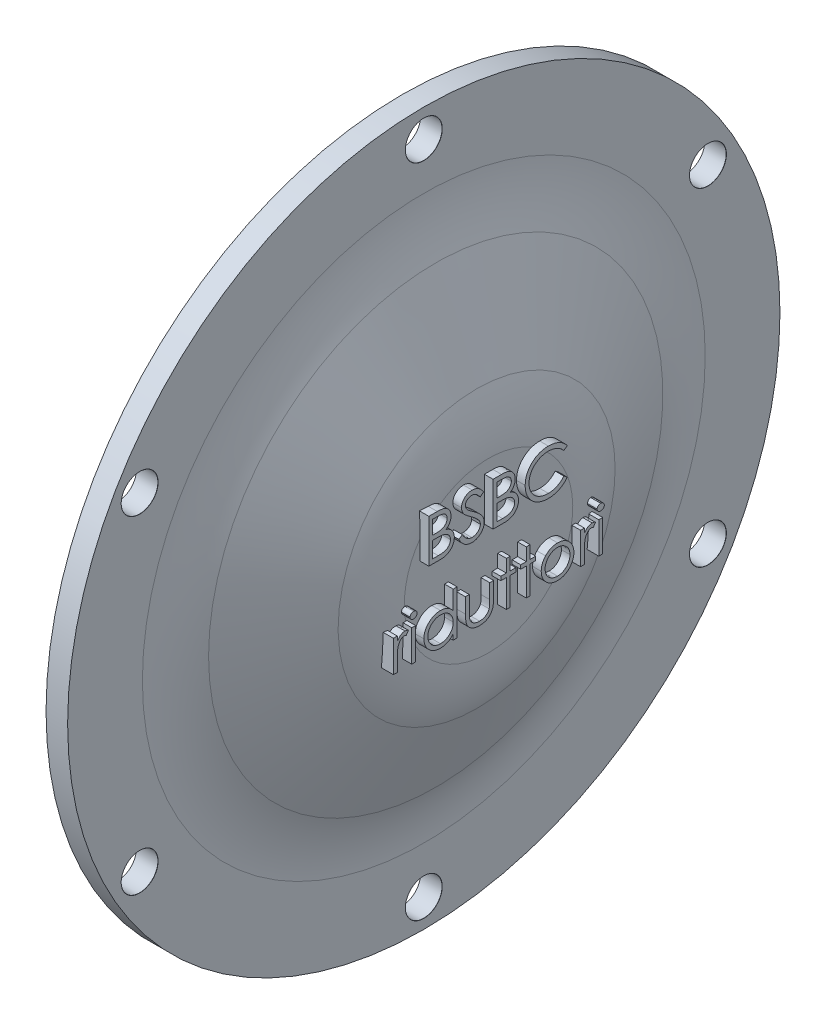
from build123d import *

# Parameters (mm, degrees)
RACCORDO4_R                             = 30
SCHIZZO5_R                              = 70
SCHIZZO5_R_2                            = 67
TAGLIO_ESTRUSIONE1_DEPTH                = 1.5
FORO_8_5_8_5_1_D                        = 8.5
FORO_8_5_8_5_1_CSINK_D                  = 8.55
FORO_8_5_8_5_1_CSINK_ANGLE              = 90
RIPETIZIONECIRCOLARE1_COUNT             = 6
ESTRUSIONE_ESTRUSIONE5_REACH            = 120.729
ESTRUSIONE_ESTRUSIONE5_END_MAJOR_RADIUS = 19.509078903
ESTRUSIONE_ESTRUSIONE5_END_MINOR_RADIUS = 30
SCHIZZO11_W                             = 0.897435897
SCHIZZO11_H                             = 7.307692307
SCHIZZO11_W_2                           = 0.897435898
SCHIZZO12_R                             = 62.5
SCHIZZO12_R_2                           = 57.5
ESTRUSIONE_ESTRUSIONE6_DEPTH            = 5
RACCORDO5_R                             = 30
SMUSSO1_SIZE                            = 1


with BuildPart() as part:
    # Schizzo4 → Rivoluzione2 (revolve)
    with BuildSketch(Plane.XY):
        Polygon((0, 0), (0, 25), (-15, 57.5), (-15, 82.5), (-10, 82.5), (-10, 58.598184219), (5, 26.098184219), (5, 0), align=None)
    revolve(axis=Axis((-10, 0, 0), (1, 0, 0)))

    # Raccordo4
    raccordo4_edges = [part.edges().sort_by_distance(p)[0] for p in [
        (5, -26.098184219, 0),
    ]]
    fillet(raccordo4_edges, radius=RACCORDO4_R)

    # Schizzo5 → Taglio-Estrusione1 (cut)
    with BuildSketch(Plane.ZY.offset(15)):
        Circle(SCHIZZO5_R)
        Circle(SCHIZZO5_R_2, mode=Mode.SUBTRACT)
    extrude(amount=-TAGLIO_ESTRUSIONE1_DEPTH, mode=Mode.SUBTRACT)

    # Foro Ø8.5 (8.5)-1 (through all)
    with Locations(Plane(origin=(-10, 0, 0), x_dir=(0, 0, -1), z_dir=(1, 0, 0))):
        with Locations((0, 76)):
            foro_8_5_8_5_1 = CounterSinkHole(FORO_8_5_8_5_1_D / 2, FORO_8_5_8_5_1_CSINK_D / 2, counter_sink_angle=FORO_8_5_8_5_1_CSINK_ANGLE)

    # RipetizioneCircolare1: Foro Ø8.5 (8.5)-1 ×6 about axis
    ripetizionecircolare1_axis = Axis((-10, 0, 0), (-1, 0, 0))
    for i in range(1, RIPETIZIONECIRCOLARE1_COUNT):
        add(foro_8_5_8_5_1.rotate(ripetizionecircolare1_axis, i * 360 / RIPETIZIONECIRCOLARE1_COUNT), mode=Mode.SUBTRACT)

    # Estrusione-Estrusione5: up to this torus (the profile starts outside it)
    estrusione_estrusione5_end = Plane(origin=(-25, 0, 0), z_dir=(-1, 0, 0)) * Torus(ESTRUSIONE_ESTRUSIONE5_END_MAJOR_RADIUS, ESTRUSIONE_ESTRUSIONE5_END_MINOR_RADIUS, mode=Mode.PRIVATE)
    # Schizzo11 → Estrusione-Estrusione5 (add, up to the surface)
    with BuildSketch(Plane(origin=(7, 0, 0), x_dir=(0, 0, -1), z_dir=(1, 0, 0)), mode=Mode.PRIVATE) as estrusione_estrusione5_sk1:
        with BuildLine():
            Line((-15.825314264, 16.793911957), (-13.874192469, 16.793911957))
            add(Edge.make_bspline(
                [(-13.874192469, 16.793911957), (-13.778682531, 16.793409813), (-13.593560502, 16.792436533), (-13.324362097, 16.777341873), (-13.072222638, 16.756759959), (-12.837069002, 16.724102551), (-12.619009853, 16.684697474), (-12.417388032, 16.636977999), (-12.232844683, 16.579759103), (-12.012522579, 16.488769728), (-11.76132069, 16.353560676), (-11.489325283, 16.153764775), (-11.256741742, 15.909386309), (-11.056209407, 15.633721579), (-10.896777636, 15.330476517), (-10.781436787, 15.006878835), (-10.708414286, 14.66710243), (-10.700904474, 14.433836207), (-10.697109136, 14.315947214)],
                knots=[0, 0, 0, 0, 1.001505555, 1.941167018, 2.826882275, 3.653841531, 4.429895133, 5.150066043, 5.825578002, 6.45369114, 7.647487171, 8.808567382, 9.977351308, 11.170798116, 12.373658725, 13.556498008, 14.765093433, 16, 16, 16, 16], degree=3))
            add(Edge.make_bspline(
                [(-10.697109136, 14.315947214), (-10.700232617, 14.20551134), (-10.706370552, 13.988494435), (-10.76506415, 13.671082694), (-10.856951774, 13.368936354), (-10.984681058, 13.08315811), (-11.150686761, 12.82020493), (-11.347424814, 12.577955598), (-11.584787107, 12.366666864), (-11.762624936, 12.248544285), (-11.852958495, 12.188543368)],
                knots=[0, 0, 0, 0, 1.044552857, 2.05264487, 3.044412934, 4.028983338, 5.005914585, 5.980388656, 6.974128949, 8, 8, 8, 8], degree=3))
            add(Edge.make_bspline(
                [(-11.852958495, 12.188543368), (-11.739357273, 12.144929085), (-11.522009995, 12.061484158), (-11.222907102, 11.913954261), (-10.965207545, 11.753491088), (-10.746929985, 11.578257231), (-10.560250971, 11.389374914), (-10.397242566, 11.184074588), (-10.258152926, 10.959678137), (-10.138973144, 10.718525179), (-10.045976699, 10.463078126), (-9.976331257, 10.195733052), (-9.93642426, 9.917448608), (-9.930745285, 9.72806181), (-9.927878366, 9.632453624)],
                knots=[0, 0, 0, 0, 1.27268992, 2.434971085, 3.483601985, 4.442670788, 5.356604649, 6.2567628, 7.179492994, 8.113709626, 9.066344395, 10.018646069, 10.999752585, 12, 12, 12, 12], degree=3))
            add(Edge.make_bspline(
                [(-9.927878366, 9.632453624), (-9.930669355, 9.534833989), (-9.936160703, 9.342764623), (-9.976674909, 9.060607096), (-10.045272357, 8.790964391), (-10.139761347, 8.532092441), (-10.263082246, 8.284492057), (-10.413162144, 8.047882731), (-10.592109468, 7.824641786), (-10.792289094, 7.612288577), (-11.018752367, 7.421352042), (-11.263083095, 7.251307166), (-11.528358295, 7.111461274), (-11.810221135, 6.993986927), (-12.111833466, 6.904252074), (-12.431840916, 6.841473292), (-12.769967493, 6.799173186), (-13.001995353, 6.795695458), (-13.120987341, 6.793911957)],
                knots=[0, 0, 0, 0, 0.978564426, 1.925352924, 2.850884081, 3.763762016, 4.682927383, 5.618979971, 6.567305752, 7.547517671, 8.540179244, 9.531824382, 10.526200242, 11.540722885, 12.589160233, 13.674978461, 14.80764778, 16, 16, 16, 16], degree=3))
            Line((-13.120987341, 6.793911957), (-15.825314264, 6.793911957))
            Line((-15.825314264, 6.793911957), (-15.825314264, 16.793911957))
        make_face()
        with BuildLine():
            Line((-14.927878366, 15.768270932), (-14.927878366, 12.563142727))
            Line((-14.927878366, 12.563142727), (-14.324913623, 12.563142727))
            add(Edge.make_bspline(
                [(-14.324913623, 12.563142727), (-14.236774207, 12.564285364), (-14.066470895, 12.566493172), (-13.819842619, 12.572817506), (-13.590913996, 12.590526201), (-13.380080187, 12.608229807), (-13.187673204, 12.637014344), (-13.014119314, 12.671277552), (-12.856694752, 12.707514424), (-12.675153193, 12.769141529), (-12.469230483, 12.860220601), (-12.249707329, 13.001568704), (-12.056180273, 13.169923999), (-11.892759736, 13.36418389), (-11.759012678, 13.578087278), (-11.666116349, 13.808221222), (-11.603124108, 14.048850171), (-11.597434018, 14.214045179), (-11.594545033, 14.297918368)],
                knots=[0, 0, 0, 0, 1.156816544, 2.235205308, 3.236616184, 4.169592532, 5.011045266, 5.787822928, 6.49130361, 7.128639758, 8.301311294, 9.436451833, 10.541879658, 11.654887649, 12.756523258, 13.837046038, 14.901820046, 16, 16, 16, 16], degree=3))
            add(Edge.make_bspline(
                [(-11.594545033, 14.297918368), (-11.596048405, 14.353420572), (-11.598997433, 14.462294206), (-11.623149726, 14.621006647), (-11.664199939, 14.770274511), (-11.716926491, 14.912143398), (-11.790608459, 15.042177256), (-11.877361211, 15.1648721), (-11.982177469, 15.276049582), (-12.101484077, 15.379962434), (-12.238651571, 15.472089657), (-12.393598119, 15.552777551), (-12.568420053, 15.617751199), (-12.760171067, 15.674654492), (-12.971802746, 15.714621045), (-13.200872899, 15.747916439), (-13.44925781, 15.76486713), (-13.62110096, 15.767111024), (-13.709929648, 15.768270932)],
                knots=[0, 0, 0, 0, 0.91205012, 1.789085906, 2.630437955, 3.453916878, 4.269457761, 5.079663411, 5.91843418, 6.774407191, 7.675494373, 8.627863946, 9.638891023, 10.736472738, 11.911756761, 13.175263542, 14.539845004, 16, 16, 16, 16], degree=3))
            Line((-13.709929648, 15.768270932), (-14.927878366, 15.768270932))
        make_face(mode=Mode.SUBTRACT)
        with BuildLine():
            Line((-14.927878366, 11.537501701), (-14.927878366, 7.819552983))
            Line((-14.927878366, 7.819552983), (-13.649833495, 7.819552983))
            add(Edge.make_bspline(
                [(-13.649833495, 7.819552983), (-13.558350849, 7.820649404), (-13.38203011, 7.822762611), (-13.127455167, 7.829661339), (-12.891503442, 7.845353555), (-12.675251626, 7.870055982), (-12.476364618, 7.896851552), (-12.297228324, 7.932883783), (-12.136390628, 7.974166527), (-11.949892606, 8.037978448), (-11.739882582, 8.137111222), (-11.51356585, 8.28658044), (-11.312348084, 8.464647034), (-11.141475915, 8.67073536), (-11.001438804, 8.894824866), (-10.899566076, 9.132383008), (-10.836735056, 9.379484515), (-10.829128858, 9.547960837), (-10.825314264, 9.632453624)],
                knots=[0, 0, 0, 0, 1.160039823, 2.235823828, 3.228722157, 4.157150951, 4.99529583, 5.772374946, 6.472645482, 7.099169577, 8.269452708, 9.405989375, 10.527446681, 11.663510218, 12.788923519, 13.866172445, 14.929861265, 16, 16, 16, 16], degree=3))
            add(Edge.make_bspline(
                [(-10.825314264, 9.632453624), (-10.826103133, 9.68529174), (-10.827668148, 9.790115688), (-10.851269905, 9.944160885), (-10.885595247, 10.093377666), (-10.929970772, 10.23817121), (-10.994597821, 10.375923714), (-11.070045093, 10.509359599), (-11.15850624, 10.638655254), (-11.296346714, 10.802118835), (-11.496838099, 10.990453158), (-11.7817146, 11.174846022), (-12.105635451, 11.323554042), (-12.340571145, 11.386695403), (-12.461932854, 11.419312598)],
                knots=[0, 0, 0, 0, 0.723448775, 1.435228256, 2.130040452, 2.821711965, 3.505591119, 4.210454504, 4.921174351, 5.648778258, 7.137944449, 8.670945889, 10.280296675, 12, 12, 12, 12], degree=3))
            add(Edge.make_bspline(
                [(-12.461932854, 11.419312598), (-12.510587413, 11.429184267), (-12.616080534, 11.45058808), (-12.788102193, 11.473181518), (-12.984490389, 11.493310261), (-13.20569861, 11.508199283), (-13.452006727, 11.523589407), (-13.723940781, 11.52957461), (-14.020390251, 11.536715354), (-14.226082744, 11.53723288), (-14.332926443, 11.537501701)],
                knots=[0, 0, 0, 0, 0.634451884, 1.375622551, 2.216452059, 3.157844607, 4.20941857, 5.370758133, 6.634282058, 8, 8, 8, 8], degree=3))
            Line((-14.332926443, 11.537501701), (-14.927878366, 11.537501701))
        make_face(mode=Mode.SUBTRACT)
    estrusione_estrusione5_tool1 = extrude(estrusione_estrusione5_sk1.sketch, amount=-ESTRUSIONE_ESTRUSIONE5_REACH, mode=Mode.PRIVATE) - estrusione_estrusione5_end
    add(estrusione_estrusione5_tool1.solids().sort_by_distance((7, 11.716905, 13.304487))[0])
    # Schizzo11 → Estrusione-Estrusione5 (add, up to the surface)
    with BuildSketch(Plane(origin=(7, 0, 0), x_dir=(0, 0, -1), z_dir=(1, 0, 0)), mode=Mode.PRIVATE) as estrusione_estrusione5_sk2:
        with BuildLine():
            Line((-8.902237341, 8.722998496), (-8.056884777, 9.229809393))
            add(Edge.make_bspline(
                [(-8.056884777, 9.229809393), (-7.978261242, 9.098196865), (-7.827621583, 8.846032339), (-7.576331985, 8.505295081), (-7.315952239, 8.215688919), (-7.044554143, 7.978898612), (-6.763794291, 7.792473221), (-6.471839852, 7.660466844), (-6.169674679, 7.578135486), (-5.964035189, 7.568135239), (-5.861371956, 7.563142727)],
                knots=[0, 0, 0, 0, 1.272034388, 2.437168799, 3.508375237, 4.49857839, 5.41946034, 6.295179144, 7.148887113, 8, 8, 8, 8], degree=3))
            add(Edge.make_bspline(
                [(-5.861371956, 7.563142727), (-5.773695212, 7.565584648), (-5.59987586, 7.570425763), (-5.343983738, 7.61694234), (-5.095464302, 7.688405566), (-4.859439623, 7.790751084), (-4.639166439, 7.914575329), (-4.446004452, 8.064135836), (-4.279015557, 8.231582138), (-4.142418087, 8.418389723), (-4.037617986, 8.619295862), (-3.957069219, 8.825512866), (-3.912369009, 9.040280204), (-3.905635428, 9.184881526), (-3.902237341, 9.257854265)],
                knots=[0, 0, 0, 0, 1.095163259, 2.171163733, 3.241058638, 4.321873601, 5.38011039, 6.391990106, 7.366004449, 8.327778327, 9.272591725, 10.192022065, 11.087607919, 12, 12, 12, 12], degree=3))
            add(Edge.make_bspline(
                [(-3.902237341, 9.257854265), (-3.906449657, 9.341113836), (-3.915012681, 9.510368376), (-3.987388338, 9.76008167), (-4.101243329, 10.007203299), (-4.206279454, 10.160064058), (-4.260811059, 10.239424778)],
                knots=[0, 0, 0, 0, 0.938893495, 1.908633276, 2.914225137, 4, 4, 4, 4], degree=3))
            add(Edge.make_bspline(
                [(-4.260811059, 10.239424778), (-4.305584242, 10.296701417), (-4.39957994, 10.416946555), (-4.561172833, 10.595932943), (-4.750790303, 10.780556997), (-4.961943317, 10.977868588), (-5.20232357, 11.178690864), (-5.464402183, 11.39260023), (-5.754870352, 11.611461878), (-5.958583199, 11.758240637), (-6.063695674, 11.83397606)],
                knots=[0, 0, 0, 0, 0.722233717, 1.516239348, 2.393582979, 3.351407094, 4.387010283, 5.505090956, 6.712668013, 8, 8, 8, 8], degree=3))
            add(Edge.make_bspline(
                [(-6.063695674, 11.83397606), (-6.168907092, 11.908914882), (-6.370063311, 12.052192202), (-6.651373546, 12.264833014), (-6.902929154, 12.45924407), (-7.123612059, 12.637255533), (-7.313325193, 12.798891546), (-7.47356351, 12.942599944), (-7.600245102, 13.072267261), (-7.670689618, 13.15638538), (-7.702317469, 13.194152342)],
                knots=[0, 0, 0, 0, 1.452282411, 2.77665338, 3.964542531, 5.026858415, 5.96415736, 6.766646006, 7.446254459, 8, 8, 8, 8], degree=3))
            add(Edge.make_bspline(
                [(-7.702317469, 13.194152342), (-7.746524741, 13.253012447), (-7.833464275, 13.368768744), (-7.94822429, 13.549696909), (-8.045764755, 13.734906238), (-8.122228561, 13.924894423), (-8.186617758, 14.11699422), (-8.229926132, 14.313712065), (-8.257044408, 14.51416526), (-8.259821513, 14.649060976), (-8.2612117, 14.716588239)],
                knots=[0, 0, 0, 0, 1.068054152, 2.10047183, 3.106115577, 4.101338837, 5.06977816, 6.043150881, 7.020423561, 8, 8, 8, 8], degree=3))
            add(Edge.make_bspline(
                [(-8.2612117, 14.716588239), (-8.257482531, 14.822387595), (-8.250103902, 15.03172492), (-8.187702425, 15.337527293), (-8.089208443, 15.629488485), (-7.951223049, 15.90471801), (-7.773344898, 16.156049384), (-7.567499257, 16.386373632), (-7.322323582, 16.579998153), (-7.053316087, 16.749175463), (-6.758869309, 16.881592392), (-6.450323871, 16.981480907), (-6.127189379, 17.038078786), (-5.90832328, 17.046200971), (-5.797269392, 17.050322214)],
                knots=[0, 0, 0, 0, 1.005424448, 1.989358655, 2.955360095, 3.929531133, 4.905563448, 5.876582895, 6.856512386, 7.866279853, 8.892233794, 9.918561126, 10.94386622, 12, 12, 12, 12], degree=3))
            add(Edge.make_bspline(
                [(-5.797269392, 17.050322214), (-5.679429105, 17.046257781), (-5.445082386, 17.03817492), (-5.100370342, 16.967896259), (-4.768482581, 16.851608626), (-4.501501824, 16.719641031), (-4.292551077, 16.587836987), (-4.133200412, 16.467780346), (-3.971721981, 16.32956575), (-3.806813253, 16.172825047), (-3.641268512, 15.996120044), (-3.472630077, 15.800660932), (-3.300503595, 15.587642201), (-3.189772566, 15.435572199), (-3.133006572, 15.35761388)],
                knots=[0, 0, 0, 0, 1.286793592, 2.559021753, 3.825965368, 5.121522368, 5.803751409, 6.523245864, 7.299691795, 8.125521123, 9.008227632, 9.944561021, 10.946284179, 12, 12, 12, 12], degree=3))
            Line((-3.133006572, 15.35761388), (-3.944304648, 14.742629906))
            add(Edge.make_bspline(
                [(-3.944304648, 14.742629906), (-3.993293027, 14.80574045), (-4.08763319, 14.927276602), (-4.230860295, 15.097480361), (-4.365856432, 15.252956017), (-4.498857574, 15.38799924), (-4.622839379, 15.510005335), (-4.743173785, 15.614461783), (-4.858129074, 15.702392056), (-5.003034533, 15.796230798), (-5.185085157, 15.88924938), (-5.413612404, 15.967961032), (-5.652430332, 16.015261209), (-5.815086422, 16.021515173), (-5.897429648, 16.024681188)],
                knots=[0, 0, 0, 0, 1.181633172, 2.275549214, 3.290209073, 4.226197932, 5.078386478, 5.862611352, 6.581680152, 7.217281963, 8.414376989, 9.595101626, 10.782541182, 12, 12, 12, 12], degree=3))
            add(Edge.make_bspline(
                [(-5.897429648, 16.024681188), (-6.000733998, 16.021219188), (-6.199946705, 16.014543048), (-6.482775951, 15.941628804), (-6.737330023, 15.826823489), (-6.956051637, 15.665923551), (-7.138157286, 15.475292144), (-7.269887168, 15.255923986), (-7.349173352, 15.01368855), (-7.358848437, 14.844712389), (-7.363775802, 14.758655547)],
                knots=[0, 0, 0, 0, 1.14458467, 2.207223713, 3.21896685, 4.227309161, 5.202851033, 6.127160689, 7.046193047, 8, 8, 8, 8], degree=3))
            add(Edge.make_bspline(
                [(-7.363775802, 14.758655547), (-7.362652583, 14.705079894), (-7.360404309, 14.597840981), (-7.329047744, 14.439408347), (-7.288763947, 14.281375949), (-7.224927856, 14.124454284), (-7.136798417, 13.965898972), (-7.021069343, 13.802979722), (-6.875317023, 13.634260554), (-6.763668416, 13.524525201), (-6.704721315, 13.466588239)],
                knots=[0, 0, 0, 0, 0.858281714, 1.717966888, 2.583508476, 3.4729293, 4.427298488, 5.488583878, 6.674047936, 8, 8, 8, 8], degree=3))
            add(Edge.make_bspline(
                [(-6.704721315, 13.466588239), (-6.68283168, 13.44705388), (-6.630826916, 13.400644713), (-6.535752843, 13.324666769), (-6.410201991, 13.230944562), (-6.257452845, 13.114980801), (-6.074688954, 12.980462337), (-5.861890222, 12.82910916), (-5.6214287, 12.656007848), (-5.450794654, 12.534986304), (-5.360570674, 12.470995291)],
                knots=[0, 0, 0, 0, 0.420754252, 0.999615792, 1.744751191, 2.668019286, 3.750313428, 4.999500688, 6.413464383, 8, 8, 8, 8], degree=3))
            add(Edge.make_bspline(
                [(-5.360570674, 12.470995291), (-5.252039493, 12.392019978), (-5.041883904, 12.23909523), (-4.742862247, 12.009336144), (-4.471737081, 11.784628234), (-4.227556499, 11.566406499), (-4.007908189, 11.356326233), (-3.815228987, 11.151860004), (-3.647555615, 10.954472653), (-3.467043562, 10.701408151), (-3.282592649, 10.390605054), (-3.124188342, 10.009810086), (-3.02430735, 9.627534885), (-3.011245877, 9.370601066), (-3.004801443, 9.243831829)],
                knots=[0, 0, 0, 0, 1.163667725, 2.253281268, 3.268753668, 4.215851969, 5.092017293, 5.902905408, 6.650798638, 7.335211899, 8.59617414, 9.77448103, 10.901945474, 12, 12, 12, 12], degree=3))
            add(Edge.make_bspline(
                [(-3.004801443, 9.243831829), (-3.006678981, 9.154179357), (-3.010397595, 8.976615404), (-3.053143063, 8.715886613), (-3.115770678, 8.462655557), (-3.210162775, 8.220052379), (-3.325371799, 7.983638771), (-3.471561078, 7.759616198), (-3.641011606, 7.543026488), (-3.835393791, 7.339645084), (-4.04809637, 7.152941667), (-4.272906926, 6.986858634), (-4.51019342, 6.84837771), (-4.75866861, 6.735375305), (-5.018389572, 6.646993826), (-5.289268955, 6.582957057), (-5.571753272, 6.543655026), (-5.763754648, 6.539575707), (-5.861371956, 6.537501701)],
                knots=[0, 0, 0, 0, 0.983748083, 1.948392443, 2.894712957, 3.844097841, 4.80183111, 5.778335162, 6.776009319, 7.81870978, 8.863265674, 9.881300176, 10.883814829, 11.87499822, 12.874611388, 13.892143829, 14.928324115, 16, 16, 16, 16], degree=3))
            add(Edge.make_bspline(
                [(-5.861371956, 6.537501701), (-5.936901508, 6.53896222), (-6.087009393, 6.541864864), (-6.309036484, 6.567525665), (-6.526578168, 6.603831675), (-6.736904688, 6.661471875), (-6.942725864, 6.731406095), (-7.143146534, 6.817515617), (-7.338263831, 6.920707621), (-7.529171211, 7.038693406), (-7.715383138, 7.176001247), (-7.895153046, 7.335925523), (-8.074379291, 7.514055537), (-8.247771852, 7.715228575), (-8.418837978, 7.936194526), (-8.584204862, 8.179020765), (-8.747295484, 8.442384632), (-8.849625393, 8.627713449), (-8.902237341, 8.722998496)],
                knots=[0, 0, 0, 0, 0.915332311, 1.819136955, 2.706846663, 3.586547465, 4.459518054, 5.340707479, 6.227863349, 7.133153174, 8.059268498, 9.028702269, 10.047606654, 11.120612155, 12.245963614, 13.433783089, 14.680604001, 16, 16, 16, 16], degree=3))
        make_face()
    estrusione_estrusione5_tool2 = extrude(estrusione_estrusione5_sk2.sketch, amount=-ESTRUSIONE_ESTRUSIONE5_REACH, mode=Mode.PRIVATE) - estrusione_estrusione5_end
    add(estrusione_estrusione5_tool2.solids().sort_by_distance((7, 11.663702, 5.753573))[0])
    # Schizzo11 → Estrusione-Estrusione5 (add, up to the surface)
    with BuildSketch(Plane(origin=(7, 0, 0), x_dir=(0, 0, -1), z_dir=(1, 0, 0)), mode=Mode.PRIVATE) as estrusione_estrusione5_sk3:
        with BuildLine():
            Line((-0.953519392, 16.793911957), (0.997602403, 16.793911957))
            add(Edge.make_bspline(
                [(0.997602403, 16.793911957), (1.093112341, 16.793409813), (1.27823437, 16.792436533), (1.547432775, 16.777341873), (1.799572234, 16.756759959), (2.03472587, 16.724102551), (2.252785019, 16.684697474), (2.45440684, 16.636977999), (2.638950189, 16.579759103), (2.859272293, 16.488769728), (3.110474181, 16.353560676), (3.382469589, 16.153764775), (3.61505313, 15.909386309), (3.815585465, 15.633721579), (3.975017236, 15.330476517), (4.090358085, 15.006878835), (4.163380586, 14.66710243), (4.170890398, 14.433836207), (4.174685736, 14.315947214)],
                knots=[0, 0, 0, 0, 1.001505555, 1.941167018, 2.826882275, 3.653841531, 4.429895133, 5.150066043, 5.825578002, 6.45369114, 7.647487171, 8.808567382, 9.977351308, 11.170798116, 12.373658725, 13.556498008, 14.765093433, 16, 16, 16, 16], degree=3))
            add(Edge.make_bspline(
                [(4.174685736, 14.315947214), (4.171562255, 14.20551134), (4.16542432, 13.988494435), (4.106730722, 13.671082694), (4.014843097, 13.368936354), (3.887113814, 13.08315811), (3.721108111, 12.82020493), (3.524370057, 12.577955598), (3.287007765, 12.366666864), (3.109169936, 12.248544285), (3.018836377, 12.188543368)],
                knots=[0, 0, 0, 0, 1.044552857, 2.05264487, 3.044412934, 4.028983338, 5.005914585, 5.980388656, 6.974128949, 8, 8, 8, 8], degree=3))
            add(Edge.make_bspline(
                [(3.018836377, 12.188543368), (3.132437599, 12.144929085), (3.349784877, 12.061484158), (3.64888777, 11.913954261), (3.906587327, 11.753491088), (4.124864887, 11.578257231), (4.311543901, 11.389374914), (4.474552305, 11.184074588), (4.613641946, 10.959678137), (4.732821727, 10.718525179), (4.825818173, 10.463078126), (4.895463614, 10.195733052), (4.935370612, 9.917448608), (4.941049587, 9.72806181), (4.943916505, 9.632453624)],
                knots=[0, 0, 0, 0, 1.27268992, 2.434971085, 3.483601985, 4.442670788, 5.356604649, 6.2567628, 7.179492994, 8.113709626, 9.066344395, 10.018646069, 10.999752585, 12, 12, 12, 12], degree=3))
            add(Edge.make_bspline(
                [(4.943916505, 9.632453624), (4.941125517, 9.534833989), (4.935634168, 9.342764623), (4.895119963, 9.060607096), (4.826522515, 8.790964391), (4.732033525, 8.532092441), (4.608712626, 8.284492057), (4.458632728, 8.047882731), (4.279685404, 7.824641786), (4.079505778, 7.612288577), (3.853042505, 7.421352042), (3.608711777, 7.251307166), (3.343436577, 7.111461274), (3.061573737, 6.993986927), (2.759961405, 6.904252074), (2.439953956, 6.841473292), (2.101827379, 6.799173186), (1.869799519, 6.795695458), (1.750807531, 6.793911957)],
                knots=[0, 0, 0, 0, 0.978564426, 1.925352924, 2.850884081, 3.763762016, 4.682927383, 5.618979971, 6.567305752, 7.547517671, 8.540179244, 9.531824382, 10.526200242, 11.540722885, 12.589160233, 13.674978461, 14.80764778, 16, 16, 16, 16], degree=3))
            Line((1.750807531, 6.793911957), (-0.953519392, 6.793911957))
            Line((-0.953519392, 6.793911957), (-0.953519392, 16.793911957))
        make_face()
        with BuildLine():
            Line((-0.056083495, 15.768270932), (-0.056083495, 12.563142727))
            Line((-0.056083495, 12.563142727), (0.546881249, 12.563142727))
            add(Edge.make_bspline(
                [(0.546881249, 12.563142727), (0.635020664, 12.564285364), (0.805323976, 12.566493172), (1.051952252, 12.572817506), (1.280880876, 12.590526201), (1.491714685, 12.608229807), (1.684121667, 12.637014344), (1.857675557, 12.671277552), (2.01510012, 12.707514424), (2.196641679, 12.769141529), (2.402564389, 12.860220601), (2.622087543, 13.001568704), (2.815614599, 13.169923999), (2.979035136, 13.36418389), (3.112782194, 13.578087278), (3.205678523, 13.808221222), (3.268670764, 14.048850171), (3.274360853, 14.214045179), (3.277249839, 14.297918368)],
                knots=[0, 0, 0, 0, 1.156816544, 2.235205308, 3.236616184, 4.169592532, 5.011045266, 5.787822928, 6.49130361, 7.128639758, 8.301311294, 9.436451833, 10.541879658, 11.654887649, 12.756523258, 13.837046038, 14.901820046, 16, 16, 16, 16], degree=3))
            add(Edge.make_bspline(
                [(3.277249839, 14.297918368), (3.275746467, 14.353420572), (3.272797439, 14.462294206), (3.248645145, 14.621006647), (3.207594933, 14.770274511), (3.154868381, 14.912143398), (3.081186413, 15.042177256), (2.994433661, 15.1648721), (2.889617403, 15.276049582), (2.770310795, 15.379962434), (2.633143301, 15.472089657), (2.478196753, 15.552777551), (2.303374819, 15.617751199), (2.111623804, 15.674654492), (1.899992126, 15.714621045), (1.670921973, 15.747916439), (1.422537062, 15.76486713), (1.250693912, 15.767111024), (1.161865223, 15.768270932)],
                knots=[0, 0, 0, 0, 0.91205012, 1.789085906, 2.630437955, 3.453916878, 4.269457761, 5.079663411, 5.91843418, 6.774407191, 7.675494373, 8.627863946, 9.638891023, 10.736472738, 11.911756761, 13.175263542, 14.539845004, 16, 16, 16, 16], degree=3))
            Line((1.161865223, 15.768270932), (-0.056083495, 15.768270932))
        make_face(mode=Mode.SUBTRACT)
        with BuildLine():
            Line((-0.056083495, 11.537501701), (-0.056083495, 7.819552983))
            Line((-0.056083495, 7.819552983), (1.221961377, 7.819552983))
            add(Edge.make_bspline(
                [(1.221961377, 7.819552983), (1.313444023, 7.820649404), (1.489764761, 7.822762611), (1.744339705, 7.829661339), (1.98029143, 7.845353555), (2.196543246, 7.870055982), (2.395430254, 7.896851552), (2.574566548, 7.932883783), (2.735404244, 7.974166527), (2.921902266, 8.037978448), (3.131912289, 8.137111222), (3.358229022, 8.28658044), (3.559446788, 8.464647034), (3.730318957, 8.67073536), (3.870356067, 8.894824866), (3.972228796, 9.132383008), (4.035059815, 9.379484515), (4.042666013, 9.547960837), (4.046480608, 9.632453624)],
                knots=[0, 0, 0, 0, 1.160039823, 2.235823828, 3.228722157, 4.157150951, 4.99529583, 5.772374946, 6.472645482, 7.099169577, 8.269452708, 9.405989375, 10.527446681, 11.663510218, 12.788923519, 13.866172445, 14.929861265, 16, 16, 16, 16], degree=3))
            add(Edge.make_bspline(
                [(4.046480608, 9.632453624), (4.045691738, 9.68529174), (4.044126724, 9.790115688), (4.020524967, 9.944160885), (3.986199625, 10.093377666), (3.941824099, 10.23817121), (3.87719705, 10.375923714), (3.801749779, 10.509359599), (3.713288631, 10.638655254), (3.575448158, 10.802118835), (3.374956773, 10.990453158), (3.090080272, 11.174846022), (2.766159421, 11.323554042), (2.531223727, 11.386695403), (2.409862018, 11.419312598)],
                knots=[0, 0, 0, 0, 0.723448775, 1.435228256, 2.130040452, 2.821711965, 3.505591119, 4.210454504, 4.921174351, 5.648778258, 7.137944449, 8.670945889, 10.280296675, 12, 12, 12, 12], degree=3))
            add(Edge.make_bspline(
                [(2.409862018, 11.419312598), (2.361207459, 11.429184267), (2.255714338, 11.45058808), (2.083692679, 11.473181518), (1.887304482, 11.493310261), (1.666096262, 11.508199283), (1.419788144, 11.523589407), (1.147854091, 11.52957461), (0.85140462, 11.536715354), (0.645712128, 11.53723288), (0.538868428, 11.537501701)],
                knots=[0, 0, 0, 0, 0.634451884, 1.375622551, 2.216452059, 3.157844607, 4.20941857, 5.370758133, 6.634282058, 8, 8, 8, 8], degree=3))
            Line((0.538868428, 11.537501701), (-0.056083495, 11.537501701))
        make_face(mode=Mode.SUBTRACT)
    estrusione_estrusione5_tool3 = extrude(estrusione_estrusione5_sk3.sketch, amount=-ESTRUSIONE_ESTRUSIONE5_REACH, mode=Mode.PRIVATE) - estrusione_estrusione5_end
    add(estrusione_estrusione5_tool3.solids().sort_by_distance((7, 11.716905, -1.567308))[0])
    # Schizzo11 → Estrusione-Estrusione5 (add, up to the surface)
    with BuildSketch(Plane(origin=(7, 0, 0), x_dir=(0, 0, -1), z_dir=(1, 0, 0)), mode=Mode.PRIVATE) as estrusione_estrusione5_sk4:
        with BuildLine():
            Line((16.225967787, 14.95897606), (15.440711377, 14.358014521))
            add(Edge.make_bspline(
                [(15.440711377, 14.358014521), (15.384694553, 14.424774435), (15.273416134, 14.557394194), (15.094389841, 14.743621464), (14.907813718, 14.91809364), (14.713759086, 15.081641867), (14.508733031, 15.228546912), (14.297702177, 15.366464349), (14.077136334, 15.490086458), (13.772131378, 15.639980704), (13.373137525, 15.796398289), (12.870866557, 15.927550379), (12.346549132, 16.011039452), (11.988841705, 16.020081856), (11.806897275, 16.024681188)],
                knots=[0, 0, 0, 0, 0.757959112, 1.505699292, 2.245454638, 2.979532153, 3.711538275, 4.438200793, 5.171680507, 5.909471876, 7.393775596, 8.890124382, 10.418191784, 12, 12, 12, 12], degree=3))
            add(Edge.make_bspline(
                [(11.806897275, 16.024681188), (11.706659277, 16.023527009), (11.507113583, 16.021229364), (11.210975088, 15.990917578), (10.92036637, 15.948314121), (10.635476467, 15.885098911), (10.356668014, 15.805177143), (10.082118294, 15.70967596), (9.815802294, 15.591519275), (9.554035899, 15.460924246), (9.303238154, 15.313417261), (9.065938017, 15.15252197), (8.843000966, 14.980038837), (8.634250645, 14.795321391), (8.43947365, 14.599201504), (8.260081334, 14.389589099), (8.096694447, 14.167154318), (7.946074376, 13.934830296), (7.811180852, 13.693293748), (7.698238339, 13.44165069), (7.598223704, 13.184210396), (7.519083011, 12.918064222), (7.456441534, 12.645084891), (7.413219639, 12.364539782), (7.383252579, 12.077014984), (7.380966359, 11.882131233), (7.379813941, 11.783895932)],
                knots=[0, 0, 0, 0, 1.054917814, 2.100044995, 3.131103042, 4.146048494, 5.169673617, 6.183595914, 7.203665975, 8.234915748, 9.262203917, 10.264457458, 11.251630812, 12.227803204, 13.197192746, 14.159520551, 15.12972552, 16.100847026, 17.073214652, 18.039054194, 19.002613845, 19.979014051, 20.95965708, 21.949030935, 22.966165397, 24, 24, 24, 24], degree=3))
            add(Edge.make_bspline(
                [(7.379813941, 11.783895932), (7.383419139, 11.63609216), (7.390497465, 11.345899061), (7.453492705, 10.920840174), (7.549221538, 10.513638249), (7.692694614, 10.126838699), (7.869606187, 9.755671962), (8.093150792, 9.406418095), (8.352055184, 9.073799339), (8.649982097, 8.765676631), (8.976855857, 8.484208845), (9.327564176, 8.23635004), (9.701233569, 8.02973609), (10.093738227, 7.857804815), (10.508098553, 7.725642736), (10.943569417, 7.632602383), (11.399203689, 7.571910438), (11.710544831, 7.566099901), (11.868996634, 7.563142727)],
                knots=[0, 0, 0, 0, 1.029171465, 2.020641659, 2.987623507, 3.938342917, 4.889210282, 5.84687017, 6.821220943, 7.821438502, 8.827599549, 9.822697543, 10.807740252, 11.797342354, 12.80366471, 13.83203677, 14.896651826, 16, 16, 16, 16], degree=3))
            add(Edge.make_bspline(
                [(11.868996634, 7.563142727), (12.043575745, 7.567967812), (12.387189199, 7.577464733), (12.891097846, 7.657919731), (13.373485748, 7.788370924), (13.834378852, 7.970936417), (14.272477841, 8.208265811), (14.688468299, 8.495974032), (15.082701358, 8.83679784), (15.319762164, 9.097035349), (15.440711377, 9.229809393)],
                knots=[0, 0, 0, 0, 1.028121516, 2.023589091, 2.998037872, 3.967518031, 4.937445131, 5.927275754, 6.942489185, 8, 8, 8, 8], degree=3))
            Line((15.440711377, 9.229809393), (16.225967787, 8.63485747))
            add(Edge.make_bspline(
                [(16.225967787, 8.63485747), (16.162773188, 8.553319036), (16.036686687, 8.390632732), (15.832520924, 8.16128499), (15.617442932, 7.945559175), (15.389855189, 7.745194543), (15.152375784, 7.556181784), (14.900740606, 7.383890837), (14.638257656, 7.225916882), (14.365816288, 7.081268526), (14.083705966, 6.952933535), (13.792264723, 6.843065627), (13.492748793, 6.748423085), (13.185144483, 6.670560409), (12.868813749, 6.609785884), (12.544898109, 6.569158241), (12.212698466, 6.5413242), (11.988580119, 6.538787298), (11.875006249, 6.537501701)],
                knots=[0, 0, 0, 0, 0.986787822, 1.968848986, 2.935600012, 3.899624008, 4.868462664, 5.837806735, 6.815139263, 7.798259679, 8.787526145, 9.778297419, 10.776456485, 11.791383307, 12.812564526, 13.85620153, 14.913611965, 16, 16, 16, 16], degree=3))
            add(Edge.make_bspline(
                [(11.875006249, 6.537501701), (11.767452915, 6.538250251), (11.554779514, 6.539730416), (11.240783081, 6.563708037), (10.935098565, 6.596421571), (10.638599633, 6.645679089), (10.349668276, 6.703805775), (10.070923749, 6.781723651), (9.799623148, 6.869006984), (9.53685646, 6.97159266), (9.282400175, 7.087353182), (9.037075, 7.218186207), (8.800993764, 7.362991535), (8.571835419, 7.518577279), (8.35298518, 7.689940999), (8.142546536, 7.874702811), (7.939339461, 8.072239985), (7.813617504, 8.214682423), (7.75040689, 8.286299778)],
                knots=[0, 0, 0, 0, 1.114604814, 2.203992996, 3.262667896, 4.300477797, 5.318619304, 6.316056647, 7.298880507, 8.271930387, 9.238335007, 10.195173496, 11.151986948, 12.108099108, 13.064862484, 14.031167946, 15.010108607, 16, 16, 16, 16], degree=3))
            add(Edge.make_bspline(
                [(7.75040689, 8.286299778), (7.649162194, 8.410703175), (7.447895118, 8.658008062), (7.190393165, 9.058825151), (6.969971578, 9.477305748), (6.791754662, 9.915648401), (6.652432567, 10.372869508), (6.555914867, 10.849199549), (6.493195997, 11.344193669), (6.486023743, 11.680870209), (6.482378044, 11.852004906)],
                knots=[0, 0, 0, 0, 0.994628077, 1.977248131, 2.950237994, 3.925870899, 4.908910175, 5.911660606, 6.938484602, 8, 8, 8, 8], degree=3))
            add(Edge.make_bspline(
                [(6.482378044, 11.852004906), (6.486821454, 12.03187763), (6.495563586, 12.385765986), (6.569837287, 12.905120139), (6.689319562, 13.402695564), (6.859024958, 13.877563406), (7.074183105, 14.332221349), (7.33997343, 14.76319622), (7.653308122, 15.173244219), (8.011729744, 15.556143508), (8.404779274, 15.906255945), (8.82569017, 16.21427367), (9.27363859, 16.47060943), (9.743689595, 16.684884179), (10.239362971, 16.849582645), (10.759601169, 16.964877465), (11.303426639, 17.036640654), (11.674462141, 17.045712677), (11.862987018, 17.050322214)],
                knots=[0, 0, 0, 0, 1.032925535, 2.032216505, 3.007276963, 3.968222605, 4.92396291, 5.891752235, 6.871517503, 7.883894988, 8.900124299, 9.891468569, 10.874487609, 11.85992873, 12.854644235, 13.869047385, 14.917252991, 16, 16, 16, 16], degree=3))
            add(Edge.make_bspline(
                [(11.862987018, 17.050322214), (11.977885509, 17.048944676), (12.205315502, 17.046217979), (12.541751652, 17.019629001), (12.869301157, 16.975304412), (13.188189677, 16.914972784), (13.499968581, 16.840094723), (13.802254983, 16.742551013), (14.09682266, 16.631018067), (14.381813826, 16.502565307), (14.655861112, 16.358374617), (14.918879165, 16.200044264), (15.168778761, 16.027770534), (15.407318328, 15.843018604), (15.630507503, 15.641879864), (15.844683156, 15.429886732), (16.042571951, 15.200932949), (16.164723936, 15.039775995), (16.225967787, 14.95897606)],
                knots=[0, 0, 0, 0, 1.096760587, 2.17092713, 3.219439832, 4.250915756, 5.268269357, 6.278326846, 7.281116186, 8.274029601, 9.260640565, 10.235837813, 11.203064059, 12.156899882, 13.114053108, 14.069676657, 15.032185724, 16, 16, 16, 16], degree=3))
        make_face()
    estrusione_estrusione5_tool4 = extrude(estrusione_estrusione5_sk4.sketch, amount=-ESTRUSIONE_ESTRUSIONE5_REACH, mode=Mode.PRIVATE) - estrusione_estrusione5_end
    add(estrusione_estrusione5_tool4.solids().sort_by_distance((7, 14.772324, -15.746226))[0])
    # Schizzo11 → Estrusione-Estrusione5 (add, up to the surface)
    with BuildSketch(Plane(origin=(7, 0, 0), x_dir=(0, 0, -1), z_dir=(1, 0, 0)), mode=Mode.PRIVATE) as estrusione_estrusione5_sk5:
        with BuildLine():
            Line((-24.030442469, -3.565062402), (-23.133006572, -3.565062402))
            Line((-23.133006572, -3.565062402), (-23.133006572, -4.640783556))
            add(Edge.make_bspline(
                [(-23.133006572, -4.640783556), (-23.066752975, -4.540624046), (-22.940043487, -4.349069762), (-22.729435117, -4.095728902), (-22.513711313, -3.885971626), (-22.29183935, -3.718818716), (-22.062187636, -3.593638376), (-21.829796345, -3.50194399), (-21.591009288, -3.44772309), (-21.430546648, -3.440484064), (-21.350154007, -3.436857273)],
                knots=[0, 0, 0, 0, 1.2804753, 2.448899062, 3.506932113, 4.484331642, 5.4025378, 6.288909075, 7.142734305, 8, 8, 8, 8], degree=3))
            add(Edge.make_bspline(
                [(-21.350154007, -3.436857273), (-21.287793075, -3.440258778), (-21.159481403, -3.447257595), (-20.965245432, -3.496431379), (-20.765121283, -3.574940015), (-20.636143034, -3.648769223), (-20.568904007, -3.687257915)],
                knots=[0, 0, 0, 0, 0.901110191, 1.854092781, 2.881294221, 4, 4, 4, 4], degree=3))
            Line((-20.568904007, -3.687257915), (-21.061692469, -4.464501504))
            add(Edge.make_bspline(
                [(-21.061692469, -4.464501504), (-21.104861101, -4.445243601), (-21.186803428, -4.408688414), (-21.306673617, -4.365425528), (-21.417191722, -4.339951483), (-21.487601889, -4.33609229), (-21.520426443, -4.334293171)],
                knots=[0, 0, 0, 0, 1.180555205, 2.24091978, 3.179933427, 4, 4, 4, 4], degree=3))
            add(Edge.make_bspline(
                [(-21.520426443, -4.334293171), (-21.592442825, -4.339093278), (-21.739335368, -4.348884104), (-21.955005366, -4.425852126), (-22.164283096, -4.550209955), (-22.330487845, -4.688127418), (-22.459179996, -4.821121125), (-22.551009212, -4.937259418), (-22.635245632, -5.067484079), (-22.715731976, -5.20956889), (-22.789064245, -5.365939879), (-22.857506157, -5.535034774), (-22.919388623, -5.717049428), (-22.954675035, -5.843856628), (-22.972750161, -5.908812402)],
                knots=[0, 0, 0, 0, 1.125678352, 2.296057538, 3.5422874, 4.923748041, 5.663163013, 6.437101912, 7.23742474, 8.08941207, 8.991984279, 9.93940061, 10.944477711, 12, 12, 12, 12], degree=3))
            add(Edge.make_bspline(
                [(-22.972750161, -5.908812402), (-22.986271285, -5.966747183), (-23.016219547, -6.095068322), (-23.045338227, -6.310349822), (-23.074108278, -6.564703132), (-23.094384331, -6.858836255), (-23.113178737, -7.192014666), (-23.123778972, -7.564745939), (-23.132645087, -7.977412657), (-23.132882421, -8.265910809), (-23.133006572, -8.416825222)],
                knots=[0, 0, 0, 0, 0.566838948, 1.255505196, 2.06880316, 3.007127437, 4.065329342, 5.249902469, 6.561414163, 8, 8, 8, 8], degree=3))
            Line((-23.133006572, -8.416825222), (-23.133006572, -10.872754709))
            Line((-23.133006572, -10.872754709), (-24.030442469, -10.872754709))
            Line((-24.030442469, -10.872754709), (-24.030442469, -3.565062402))
        make_face()
    estrusione_estrusione5_tool5 = extrude(estrusione_estrusione5_sk5.sketch, amount=-ESTRUSIONE_ESTRUSIONE5_REACH, mode=Mode.PRIVATE) - estrusione_estrusione5_end
    add(estrusione_estrusione5_tool5.solids().sort_by_distance((7, -6.445749, 23.173785))[0])
    # Schizzo11 → Estrusione-Estrusione5 (add, up to the surface)
    with BuildSketch(Plane(origin=(7, 0, 0), x_dir=(0, 0, -1), z_dir=(1, 0, 0)), mode=Mode.PRIVATE) as estrusione_estrusione5_sk6:
        with BuildLine():
            add(Edge.make_bspline(
                [(-19.3549617, -0.488139325), (-19.299272226, -0.490722617), (-19.190221541, -0.4957812), (-19.03252649, -0.539099706), (-18.888935027, -0.612527379), (-18.761570076, -0.711040753), (-18.652278971, -0.826896306), (-18.575762656, -0.961927644), (-18.526584381, -1.107809469), (-18.520645652, -1.209566866), (-18.517621956, -1.261376504)],
                knots=[0, 0, 0, 0, 1.055194115, 2.066272739, 3.074728998, 4.095836921, 5.109056067, 6.073838105, 7.019297344, 8, 8, 8, 8], degree=3))
            add(Edge.make_bspline(
                [(-18.517621956, -1.261376504), (-18.520713841, -1.311841228), (-18.526826133, -1.411604013), (-18.57572467, -1.554956791), (-18.652931064, -1.688111886), (-18.761499995, -1.803742487), (-18.888953597, -1.902201401), (-19.032521557, -1.975643512), (-19.190222838, -2.01895819), (-19.299272665, -2.024017301), (-19.3549617, -2.026600863)],
                knots=[0, 0, 0, 0, 0.96129708, 1.900370562, 2.859976407, 3.87933698, 4.906634145, 5.921202961, 6.938410037, 8, 8, 8, 8], degree=3))
            add(Edge.make_bspline(
                [(-19.3549617, -2.026600863), (-19.410013914, -2.024115948), (-19.517165858, -2.019279386), (-19.672499693, -1.974793621), (-19.814866806, -1.902176269), (-19.942480156, -1.804387169), (-20.048852136, -1.687401748), (-20.126275923, -1.555038052), (-20.175061529, -1.411583324), (-20.181189039, -1.311834278), (-20.184288623, -1.261376504)],
                knots=[0, 0, 0, 0, 1.054934014, 2.053291228, 3.073705704, 4.106921865, 5.123545215, 6.088680038, 7.033164197, 8, 8, 8, 8], degree=3))
            add(Edge.make_bspline(
                [(-20.184288623, -1.261376504), (-20.181256947, -1.209574077), (-20.175302544, -1.107830841), (-20.126239355, -0.961845032), (-20.049497047, -0.82761217), (-19.942409722, -0.710396458), (-19.81488555, -0.612552358), (-19.67249485, -0.539949554), (-19.517167137, -0.495460013), (-19.410014349, -0.490623972), (-19.3549617, -0.488139325)],
                knots=[0, 0, 0, 0, 0.98631895, 1.937192651, 2.907499808, 3.917963147, 4.944918757, 5.95915025, 6.951458133, 8, 8, 8, 8], degree=3))
        make_face()
    estrusione_estrusione5_tool6 = extrude(estrusione_estrusione5_sk6.sketch, amount=-ESTRUSIONE_ESTRUSIONE5_REACH, mode=Mode.PRIVATE) - estrusione_estrusione5_end
    add(estrusione_estrusione5_tool6.solids().sort_by_distance((7, -1.257424, 19.351224))[0])
    # Schizzo11 → Estrusione-Estrusione5 (add, up to the surface)
    with BuildSketch(Plane(origin=(7, 0, 0), x_dir=(0, 0, -1), z_dir=(1, 0, 0)), mode=Mode.PRIVATE) as estrusione_estrusione5_sk7:
        with Locations((-19.350955289, -7.218908556)):
            Rectangle(SCHIZZO11_W, SCHIZZO11_H)
    estrusione_estrusione5_tool7 = extrude(estrusione_estrusione5_sk7.sketch, amount=-ESTRUSIONE_ESTRUSIONE5_REACH, mode=Mode.PRIVATE) - estrusione_estrusione5_end
    add(estrusione_estrusione5_tool7.solids().sort_by_distance((7, -7.218909, 19.350955))[0])
    # Schizzo11 → Estrusione-Estrusione5 (add, up to the surface)
    with BuildSketch(Plane(origin=(7, 0, 0), x_dir=(0, 0, -1), z_dir=(1, 0, 0)), mode=Mode.PRIVATE) as estrusione_estrusione5_sk8:
        with BuildLine():
            Line((-9.286852725, -0.616344453), (-9.286852725, -10.872754709))
            Line((-9.286852725, -10.872754709), (-10.184288623, -10.872754709))
            Line((-10.184288623, -10.872754709), (-10.184288623, -9.608732273))
            add(Edge.make_bspline(
                [(-10.184288623, -9.608732273), (-10.285485167, -9.723131113), (-10.482971497, -9.946381888), (-10.812803262, -10.238045238), (-11.162426628, -10.479126157), (-11.530144688, -10.673840201), (-11.915625384, -10.82010322), (-12.318014204, -10.924063674), (-12.737475293, -10.990903203), (-13.023910592, -10.997577551), (-13.169064264, -11.000959838)],
                knots=[0, 0, 0, 0, 1.074387032, 2.096679803, 3.090159297, 4.057316773, 5.018401886, 5.985159533, 6.978961417, 8, 8, 8, 8], degree=3))
            add(Edge.make_bspline(
                [(-13.169064264, -11.000959838), (-13.29811556, -10.997455917), (-13.552610432, -10.99054603), (-13.926979223, -10.936939448), (-14.287242793, -10.850851958), (-14.633741572, -10.731135131), (-14.964233416, -10.572332783), (-15.281547978, -10.382214932), (-15.584041384, -10.15581256), (-15.867102924, -9.896989622), (-16.127765782, -9.615861087), (-16.356512275, -9.316016667), (-16.547235361, -8.998752942), (-16.706721306, -8.668086788), (-16.829568004, -8.321472732), (-16.915206959, -7.960109395), (-16.968751092, -7.584424042), (-16.975658123, -7.328596833), (-16.979160418, -7.198876504)],
                knots=[0, 0, 0, 0, 1.033919861, 2.038935746, 3.024066025, 3.998881131, 4.97069526, 5.957263378, 6.95902576, 7.993208707, 9.027059324, 10.027763471, 11.009749337, 11.988697705, 12.965288445, 13.950418724, 14.960734635, 16, 16, 16, 16], degree=3))
            add(Edge.make_bspline(
                [(-16.979160418, -7.198876504), (-16.975580499, -7.071837351), (-16.968503194, -6.820687799), (-16.915779709, -6.45132009), (-16.827119684, -6.095553631), (-16.702697262, -5.754533793), (-16.54314882, -5.427847936), (-16.349068571, -5.115265007), (-16.1204425, -4.815923872), (-15.856864195, -4.536863223), (-15.57133628, -4.27909004), (-15.265882763, -4.055064196), (-14.948101959, -3.861587485), (-14.613064786, -3.708291838), (-14.265730201, -3.584265825), (-13.90300607, -3.498457345), (-13.52640156, -3.44789357), (-13.27071444, -3.440571387), (-13.141019392, -3.436857273)],
                knots=[0, 0, 0, 0, 1.020392517, 2.01726096, 2.990465484, 3.961182959, 4.928053699, 5.906110375, 6.912531644, 7.948652711, 8.985773172, 9.998621852, 10.987621588, 11.969261332, 12.953316658, 13.946091881, 14.958173133, 16, 16, 16, 16], degree=3))
            add(Edge.make_bspline(
                [(-13.141019392, -3.436857273), (-12.991828513, -3.441334691), (-12.698983397, -3.450123363), (-12.270701907, -3.523570126), (-11.865594448, -3.646892634), (-11.481328769, -3.815724866), (-11.12019574, -4.035155584), (-10.779548196, -4.300159721), (-10.46531013, -4.618237281), (-10.279390637, -4.857127491), (-10.184288623, -4.979325222)],
                knots=[0, 0, 0, 0, 1.031072012, 2.023879775, 2.993683497, 3.952812103, 4.918022106, 5.908088563, 6.929940113, 8, 8, 8, 8], degree=3))
            Line((-10.184288623, -4.979325222), (-10.184288623, -0.616344453))
            Line((-10.184288623, -0.616344453), (-9.286852725, -0.616344453))
        make_face()
        with BuildLine():
            add(Edge.make_bspline(
                [(-13.129000161, -4.334293171), (-13.260183984, -4.338960707), (-13.519119984, -4.348173682), (-13.899245704, -4.420097954), (-14.262998316, -4.539768223), (-14.608558528, -4.703430798), (-14.930467718, -4.909227188), (-15.21816392, -5.158145426), (-15.47400021, -5.443394038), (-15.689166679, -5.763685782), (-15.864568099, -6.107051757), (-15.987902476, -6.465978723), (-16.069243183, -6.833992944), (-16.077553242, -7.083600618), (-16.08172452, -7.20889253)],
                knots=[0, 0, 0, 0, 1.031046209, 2.035121221, 3.029706178, 4.034933723, 5.034054252, 6.02443088, 7.017295772, 8.038157696, 9.050218397, 10.03989886, 11.016116709, 12, 12, 12, 12], degree=3))
            add(Edge.make_bspline(
                [(-16.08172452, -7.20889253), (-16.076396254, -7.333435693), (-16.065760605, -7.582033853), (-15.98933005, -7.950549787), (-15.86110184, -8.309561335), (-15.686124518, -8.656021317), (-15.467019876, -8.977690175), (-15.213052297, -9.268376239), (-14.921765779, -9.518346492), (-14.599115759, -9.727596702), (-14.254521558, -9.896632476), (-13.892138897, -10.014248589), (-13.51877993, -10.090185105), (-13.264916119, -10.099055039), (-13.137012982, -10.10352394)],
                knots=[0, 0, 0, 0, 0.979072187, 1.954306742, 2.945804271, 3.96968567, 4.997920485, 5.998718438, 6.996577872, 8.005894225, 9.015743152, 10.005417472, 10.995077863, 12, 12, 12, 12], degree=3))
            add(Edge.make_bspline(
                [(-13.137012982, -10.10352394), (-13.007165831, -10.098781186), (-12.748912727, -10.089348319), (-12.367659276, -10.017116132), (-11.997673668, -9.897776708), (-11.643995872, -9.732350632), (-11.314521212, -9.527329615), (-11.01881299, -9.287309355), (-10.768767366, -9.0081574), (-10.556788482, -8.701367534), (-10.390573005, -8.365047545), (-10.26949855, -8.006949857), (-10.197915963, -7.627062005), (-10.188893878, -7.367450785), (-10.184288623, -7.234934197)],
                knots=[0, 0, 0, 0, 1.01762866, 2.023962475, 3.030623092, 4.058876274, 5.077231937, 6.066672613, 7.034107872, 8.005628644, 8.981990164, 9.965428785, 10.961468474, 12, 12, 12, 12], degree=3))
            add(Edge.make_bspline(
                [(-10.184288623, -7.234934197), (-10.187030498, -7.133968967), (-10.192427377, -6.935237443), (-10.233657575, -6.643444535), (-10.299243079, -6.364205318), (-10.391660708, -6.097226207), (-10.513064378, -5.843983305), (-10.659486566, -5.602658276), (-10.833502137, -5.374506244), (-11.03230984, -5.162668898), (-11.249924704, -4.969450434), (-11.48019482, -4.796981175), (-11.725848383, -4.655298967), (-11.982754203, -4.538038192), (-12.251358015, -4.444726335), (-12.533845501, -4.382475781), (-12.827214035, -4.339732007), (-13.027345622, -4.336125205), (-13.129000161, -4.334293171)],
                knots=[0, 0, 0, 0, 1.050140795, 2.067009409, 3.05949893, 4.030605086, 5.00011959, 5.97591094, 6.962425594, 7.979863591, 8.993523472, 9.986985069, 10.967611495, 11.937549037, 12.921786183, 13.919465291, 14.943216303, 16, 16, 16, 16], degree=3))
        make_face(mode=Mode.SUBTRACT)
    estrusione_estrusione5_tool8 = extrude(estrusione_estrusione5_sk8.sketch, amount=-ESTRUSIONE_ESTRUSIONE5_REACH, mode=Mode.PRIVATE) - estrusione_estrusione5_end
    add(estrusione_estrusione5_tool8.solids().sort_by_distance((7, -5.74455, 9.416086))[0])
    # Schizzo11 → Estrusione-Estrusione5 (add, up to the surface)
    with BuildSketch(Plane(origin=(7, 0, 0), x_dir=(0, 0, -1), z_dir=(1, 0, 0)), mode=Mode.PRIVATE) as estrusione_estrusione5_sk9:
        with BuildLine():
            Line((-7.363775802, -3.565062402), (-6.466339905, -3.565062402))
            Line((-6.466339905, -3.565062402), (-6.466339905, -6.954485479))
            add(Edge.make_bspline(
                [(-6.466339905, -6.954485479), (-6.465934462, -7.053979048), (-6.46515887, -7.244305585), (-6.459899038, -7.518177547), (-6.447527342, -7.767939583), (-6.432059272, -7.993735974), (-6.412167455, -8.195528521), (-6.388500711, -8.372612399), (-6.362048077, -8.526995782), (-6.336154609, -8.619976798), (-6.324112341, -8.663219453)],
                knots=[0, 0, 0, 0, 1.388932606, 2.656963016, 3.823490214, 4.879454478, 5.816252168, 6.653371382, 7.373723809, 8, 8, 8, 8], degree=3))
            add(Edge.make_bspline(
                [(-6.324112341, -8.663219453), (-6.304793898, -8.717570513), (-6.266558638, -8.825142687), (-6.197205827, -8.980539845), (-6.11141058, -9.124469223), (-6.017525357, -9.26248086), (-5.909241335, -9.390486537), (-5.787928561, -9.50827009), (-5.657647884, -9.620281779), (-5.464062103, -9.752809756), (-5.199321343, -9.894853557), (-4.851742042, -10.017413038), (-4.474872825, -10.090658238), (-4.214402198, -10.099156109), (-4.080522597, -10.10352394)],
                knots=[0, 0, 0, 0, 0.725840625, 1.436591201, 2.137033971, 2.831655856, 3.53531722, 4.242432219, 4.957935707, 5.694543706, 7.190802206, 8.724350549, 10.316345118, 12, 12, 12, 12], degree=3))
            add(Edge.make_bspline(
                [(-4.080522597, -10.10352394), (-3.946655432, -10.09906323), (-3.687647237, -10.090432581), (-3.314918753, -10.019622471), (-2.974200427, -9.901320502), (-2.668911994, -9.736156468), (-2.400438165, -9.534036289), (-2.176711254, -9.296868264), (-1.992119099, -9.03215573), (-1.911520754, -8.83465779), (-1.870987341, -8.735334838)],
                knots=[0, 0, 0, 0, 1.157059328, 2.238695713, 3.266970494, 4.264342957, 5.228770407, 6.160125903, 7.074715775, 8, 8, 8, 8], degree=3))
            add(Edge.make_bspline(
                [(-1.870987341, -8.735334838), (-1.859003826, -8.695431127), (-1.832511202, -8.607213769), (-1.804047341, -8.457557345), (-1.778406022, -8.279087046), (-1.756511233, -8.070635021), (-1.740896483, -7.832746014), (-1.732479264, -7.565494368), (-1.722969906, -7.269719053), (-1.722825574, -7.062668313), (-1.722750161, -6.954485479)],
                knots=[0, 0, 0, 0, 0.557542046, 1.232589297, 2.036731608, 2.971723315, 4.038036528, 5.22795436, 6.551621927, 8, 8, 8, 8], degree=3))
            Line((-1.722750161, -6.954485479), (-1.722750161, -3.565062402))
            Line((-1.722750161, -3.565062402), (-0.825314264, -3.565062402))
            Line((-0.825314264, -3.565062402), (-0.825314264, -7.122754709))
            add(Edge.make_bspline(
                [(-0.825314264, -7.122754709), (-0.826576249, -7.243632342), (-0.829024673, -7.478151485), (-0.84475994, -7.818963232), (-0.871758833, -8.136569646), (-0.912737933, -8.431138845), (-0.960925575, -8.702445936), (-1.023086355, -8.950838639), (-1.097309891, -9.17555165), (-1.181039934, -9.380528156), (-1.279959556, -9.566376425), (-1.385179614, -9.742764472), (-1.506678962, -9.905315715), (-1.634593917, -10.062121822), (-1.776884363, -10.205383329), (-1.93088396, -10.338387545), (-2.094425159, -10.463167636), (-2.271137154, -10.574857006), (-2.458440191, -10.675475992), (-2.656565496, -10.764664787), (-2.867939777, -10.835243579), (-3.089835883, -10.896131195), (-3.323340966, -10.943886821), (-3.568229918, -10.977562726), (-3.82442025, -10.998206529), (-3.999018706, -11.000026657), (-4.088535418, -11.000959838)],
                knots=[0, 0, 0, 0, 1.493040784, 2.896703357, 4.213163133, 5.428574705, 6.569057535, 7.615249723, 8.588095153, 9.490268104, 10.346124644, 11.18633936, 12.024365274, 12.850166724, 13.684164916, 14.514361689, 15.362232829, 16.222528818, 17.093394965, 17.986930858, 18.902426812, 19.842810585, 20.827885679, 21.843828298, 22.894529745, 24, 24, 24, 24], degree=3))
            add(Edge.make_bspline(
                [(-4.088535418, -11.000959838), (-4.177382601, -10.999989246), (-4.351975587, -10.998081942), (-4.608179142, -10.977676778), (-4.853746588, -10.943939147), (-5.08780487, -10.895781383), (-5.310588862, -10.835669755), (-5.523000976, -10.764231082), (-5.722554013, -10.675429706), (-5.911645453, -10.575493827), (-6.088795134, -10.462450183), (-6.254819643, -10.338541498), (-6.409496364, -10.203952747), (-6.552859416, -10.059246012), (-6.682896492, -9.902626194), (-6.801228039, -9.735353165), (-6.909675768, -9.55908434), (-7.007826598, -9.370332447), (-7.092145899, -9.162983848), (-7.166589459, -8.93356357), (-7.227476997, -8.67955638), (-7.277026907, -8.401179441), (-7.316888166, -8.099765037), (-7.344562858, -7.773569564), (-7.36003666, -7.423387587), (-7.36250255, -7.181530758), (-7.363775802, -7.05664894)],
                knots=[0, 0, 0, 0, 1.083640291, 2.129454052, 3.13281866, 4.105697902, 5.042300162, 5.946461698, 6.836384745, 7.703652036, 8.553297018, 9.397182691, 10.228592656, 11.052265423, 11.879314572, 12.708807002, 13.549817954, 14.402308542, 15.300838682, 16.27712199, 17.341985831, 18.484375296, 19.725102775, 21.0496083, 22.476576903, 24, 24, 24, 24], degree=3))
            Line((-7.363775802, -7.05664894), (-7.363775802, -3.565062402))
        make_face()
    estrusione_estrusione5_tool9 = extrude(estrusione_estrusione5_sk9.sketch, amount=-ESTRUSIONE_ESTRUSIONE5_REACH, mode=Mode.PRIVATE) - estrusione_estrusione5_end
    add(estrusione_estrusione5_tool9.solids().sort_by_distance((7, -3.66408, 6.915058))[0])
    # Schizzo11 → Estrusione-Estrusione5 (add, up to the surface)
    with BuildSketch(Plane(origin=(7, 0, 0), x_dir=(0, 0, -1), z_dir=(1, 0, 0)), mode=Mode.PRIVATE) as estrusione_estrusione5_sk10:
        Polygon((2.123403685, -0.616344453), (3.020839582, -0.616344453), (3.020839582, -3.565062402), (4.302890864, -3.565062402), (4.302890864, -4.462498299), (3.020839582, -4.462498299), (3.020839582, -10.872754709), (2.123403685, -10.872754709), (2.123403685, -4.462498299), (0.841352403, -4.462498299), (0.841352403, -3.565062402), (2.123403685, -3.565062402), align=None)
    estrusione_estrusione5_tool10 = extrude(estrusione_estrusione5_sk10.sketch, amount=-ESTRUSIONE_ESTRUSIONE5_REACH, mode=Mode.PRIVATE) - estrusione_estrusione5_end
    add(estrusione_estrusione5_tool10.solids().sort_by_distance((7, -5.398396, -2.572122))[0])
    # Schizzo11 → Estrusione-Estrusione5 (add, up to the surface)
    with BuildSketch(Plane(origin=(7, 0, 0), x_dir=(0, 0, -1), z_dir=(1, 0, 0)), mode=Mode.PRIVATE) as estrusione_estrusione5_sk11:
        Polygon((6.7387883, -0.616344453), (7.636224198, -0.616344453), (7.636224198, -3.565062402), (8.91827548, -3.565062402), (8.91827548, -4.462498299), (7.636224198, -4.462498299), (7.636224198, -10.872754709), (6.7387883, -10.872754709), (6.7387883, -4.462498299), (5.456737018, -4.462498299), (5.456737018, -3.565062402), (6.7387883, -3.565062402), align=None)
    estrusione_estrusione5_tool11 = extrude(estrusione_estrusione5_sk11.sketch, amount=-ESTRUSIONE_ESTRUSIONE5_REACH, mode=Mode.PRIVATE) - estrusione_estrusione5_end
    add(estrusione_estrusione5_tool11.solids().sort_by_distance((7, -5.398396, -7.187506))[0])
    # Schizzo11 → Estrusione-Estrusione5 (add, up to the surface)
    with BuildSketch(Plane(origin=(7, 0, 0), x_dir=(0, 0, -1), z_dir=(1, 0, 0)), mode=Mode.PRIVATE) as estrusione_estrusione5_sk12:
        with BuildLine():
            add(Edge.make_bspline(
                [(13.986384454, -3.436857273), (14.123502377, -3.439776962), (14.392357112, -3.445501759), (14.786093929, -3.506687375), (15.161937175, -3.600251273), (15.521326295, -3.729598594), (15.859658568, -3.902975595), (16.181862123, -4.109859284), (16.487053577, -4.354952409), (16.669976517, -4.54454689), (16.762826762, -4.640783556)],
                knots=[0, 0, 0, 0, 1.054011418, 2.066658804, 3.057071809, 4.030435133, 4.997543892, 5.974964718, 6.972108034, 8, 8, 8, 8], degree=3))
            add(Edge.make_bspline(
                [(16.762826762, -4.640783556), (16.842775202, -4.732823515), (17.00112486, -4.915122207), (17.204169771, -5.210709673), (17.379088514, -5.516824246), (17.519268402, -5.837530893), (17.629797042, -6.170029954), (17.708270459, -6.515464271), (17.754947416, -6.873070978), (17.761241608, -7.115939086), (17.764429326, -7.238940607)],
                knots=[0, 0, 0, 0, 1.025258237, 2.030674902, 3.01204498, 3.988269485, 4.97094183, 5.956517959, 6.965070386, 8, 8, 8, 8], degree=3))
            add(Edge.make_bspline(
                [(17.764429326, -7.238940607), (17.761625505, -7.362655057), (17.756085024, -7.607120581), (17.703674692, -7.967175912), (17.622157303, -8.316303977), (17.505494909, -8.653043102), (17.355900311, -8.978422609), (17.173355489, -9.291021321), (16.95657944, -9.591455987), (16.710853735, -9.877175525), (16.439276946, -10.140507568), (16.144659379, -10.370016909), (15.832790712, -10.566649836), (15.499523988, -10.725039595), (15.147902597, -10.849924453), (14.777168117, -10.937638785), (14.387896487, -10.990672168), (14.122104426, -10.997482377), (13.986384454, -11.000959838)],
                knots=[0, 0, 0, 0, 0.998656419, 1.973391657, 2.932242238, 3.890759089, 4.846373663, 5.82037756, 6.809684879, 7.83454468, 8.860553229, 9.859544525, 10.845671541, 11.83227036, 12.833544569, 13.85385346, 14.904124723, 16, 16, 16, 16], degree=3))
            add(Edge.make_bspline(
                [(13.986384454, -11.000959838), (13.849999541, -10.997470706), (13.582882799, -10.990637064), (13.192237137, -10.937844828), (12.820838225, -10.849964878), (12.468756515, -10.724629184), (12.134056953, -10.566644773), (11.820381247, -10.370611375), (11.525524345, -10.140439502), (11.253890104, -9.877193968), (11.008179803, -9.591451236), (10.791399779, -9.291022554), (10.60885599, -8.978422287), (10.459261122, -8.653043187), (10.3425988, -8.316303954), (10.261081392, -7.967175918), (10.208671065, -7.607120579), (10.203130583, -7.362655057), (10.200326762, -7.238940607)],
                knots=[0, 0, 0, 0, 1.099876186, 2.154163076, 3.173186993, 4.173200201, 5.163417411, 6.152872554, 7.150605724, 8.17532212, 9.198891216, 10.186952605, 11.159729845, 12.11414092, 13.071450619, 14.029093627, 15.002601286, 16, 16, 16, 16], degree=3))
            add(Edge.make_bspline(
                [(10.200326762, -7.238940607), (10.20353622, -7.116607619), (10.209890396, -6.874409326), (10.256520421, -6.517474867), (10.334687726, -6.172625184), (10.445348858, -5.841409538), (10.586820832, -5.522108292), (10.759281655, -5.215237347), (10.964397748, -4.920986488), (11.12211761, -4.738923402), (11.201929326, -4.646793171)],
                knots=[0, 0, 0, 0, 1.031353054, 2.041901799, 3.029428768, 4.008703097, 4.981709435, 5.96992636, 6.972712378, 8, 8, 8, 8], degree=3))
            add(Edge.make_bspline(
                [(11.201929326, -4.646793171), (11.294639586, -4.549721916), (11.476970626, -4.358814212), (11.783681276, -4.114435572), (12.105092194, -3.90324679), (12.447163411, -3.733314746), (12.806257291, -3.599490409), (13.184026555, -3.50644608), (13.579099457, -3.445722209), (13.849269803, -3.439841701), (13.986384454, -3.436857273)],
                knots=[0, 0, 0, 0, 1.027980169, 2.021703884, 2.998553061, 3.971491411, 4.943284454, 5.930300938, 6.949603206, 8, 8, 8, 8], degree=3))
        make_face()
        with BuildLine():
            add(Edge.make_bspline(
                [(13.982378044, -4.334293171), (13.88541344, -4.337049147), (13.693987358, -4.342489954), (13.412217116, -4.383872539), (13.140959533, -4.449436837), (12.879699979, -4.542591283), (12.629319486, -4.662873851), (12.389578336, -4.810612023), (12.159771365, -4.983849042), (11.944394041, -5.182313818), (11.746730292, -5.399110945), (11.573936074, -5.630106256), (11.427007198, -5.87155296), (11.304606744, -6.123702135), (11.21344335, -6.389109032), (11.147234714, -6.664767978), (11.10589117, -6.951240596), (11.100501517, -7.145986363), (11.097762659, -7.244950222)],
                knots=[0, 0, 0, 0, 1.021534396, 2.016698045, 2.994645724, 3.958388632, 4.93408049, 5.916473867, 6.921342795, 7.962252576, 8.998418191, 10.008913653, 10.997312074, 11.973003931, 12.956656626, 13.948281152, 14.957379055, 16, 16, 16, 16], degree=3))
            add(Edge.make_bspline(
                [(11.097762659, -7.244950222), (11.102353584, -7.372813157), (11.111465711, -7.626597173), (11.185566386, -8.000343237), (11.309527186, -8.359148529), (11.476919414, -8.700909632), (11.686651467, -9.017116141), (11.933757372, -9.299034668), (12.215585087, -9.5424227), (12.528775088, -9.744367973), (12.866930282, -9.904824418), (13.224805485, -10.018535777), (13.598064611, -10.092454898), (13.853152414, -10.099801968), (13.982378044, -10.10352394)],
                knots=[0, 0, 0, 0, 1.016792936, 2.018143844, 3.017858371, 4.030088057, 5.03801393, 6.028138512, 7.003788237, 7.991172063, 8.984598303, 9.972568034, 10.972917682, 12, 12, 12, 12], degree=3))
            add(Edge.make_bspline(
                [(13.982378044, -10.10352394), (14.111596241, -10.099780282), (14.366669372, -10.092390406), (14.739409877, -10.018908063), (15.09630694, -9.904326176), (15.434110904, -9.744548433), (15.747158343, -9.54165582), (16.031012975, -9.300409028), (16.276009007, -9.016369453), (16.485533592, -8.700490799), (16.655667143, -8.359678364), (16.779047719, -8.000277015), (16.853326536, -7.626614038), (16.862414618, -7.372818807), (16.866993428, -7.244950222)],
                knots=[0, 0, 0, 0, 1.02726834, 2.027799167, 3.010890988, 4.004497153, 4.992059811, 5.971914811, 6.958719428, 7.966827853, 8.981595046, 9.981490638, 10.983022906, 12, 12, 12, 12], degree=3))
            add(Edge.make_bspline(
                [(16.866993428, -7.244950222), (16.864255514, -7.145985772), (16.858867717, -6.951238841), (16.817510676, -6.664774688), (16.751351991, -6.389084412), (16.660004513, -6.123792974), (16.538135902, -5.870900104), (16.388373636, -5.63081517), (16.216284992, -5.398310753), (16.016236075, -5.183014636), (15.801083567, -4.983771675), (15.571183458, -4.810544848), (15.331797805, -4.663523146), (15.082144711, -4.541562459), (14.820851661, -4.450284344), (14.549974149, -4.383493968), (14.269406121, -4.342664835), (14.078665997, -4.337101573), (13.982378044, -4.334293171)],
                knots=[0, 0, 0, 0, 1.042956736, 2.052379634, 3.044323526, 4.02829302, 5.004299113, 5.996692471, 7.007513377, 8.048758398, 9.090003419, 10.095195979, 11.07790575, 12.047570684, 13.018257071, 13.989683339, 14.985167495, 16, 16, 16, 16], degree=3))
        make_face(mode=Mode.SUBTRACT)
    estrusione_estrusione5_tool12 = extrude(estrusione_estrusione5_sk12.sketch, amount=-ESTRUSIONE_ESTRUSIONE5_REACH, mode=Mode.PRIVATE) - estrusione_estrusione5_end
    add(estrusione_estrusione5_tool12.solids().sort_by_distance((7, -3.830923, -15.465727))[0])
    # Schizzo11 → Estrusione-Estrusione5 (add, up to the surface)
    with BuildSketch(Plane(origin=(7, 0, 0), x_dir=(0, 0, -1), z_dir=(1, 0, 0)), mode=Mode.PRIVATE) as estrusione_estrusione5_sk13:
        with BuildLine():
            Line((19.302890864, -3.565062402), (20.200326762, -3.565062402))
            Line((20.200326762, -3.565062402), (20.200326762, -4.640783556))
            add(Edge.make_bspline(
                [(20.200326762, -4.640783556), (20.266580358, -4.540624046), (20.393289847, -4.349069762), (20.603898216, -4.095728902), (20.81962202, -3.885971626), (21.041493984, -3.718818716), (21.271145698, -3.593638376), (21.503536988, -3.50194399), (21.742324045, -3.44772309), (21.902786686, -3.440484064), (21.983179326, -3.436857273)],
                knots=[0, 0, 0, 0, 1.2804753, 2.448899062, 3.506932113, 4.484331642, 5.4025378, 6.288909075, 7.142734305, 8, 8, 8, 8], degree=3))
            add(Edge.make_bspline(
                [(21.983179326, -3.436857273), (22.045540259, -3.440258778), (22.173851931, -3.447257595), (22.368087902, -3.496431379), (22.56821205, -3.574940015), (22.697190299, -3.648769223), (22.764429326, -3.687257915)],
                knots=[0, 0, 0, 0, 0.901110191, 1.854092781, 2.881294221, 4, 4, 4, 4], degree=3))
            Line((22.764429326, -3.687257915), (22.271640864, -4.464501504))
            add(Edge.make_bspline(
                [(22.271640864, -4.464501504), (22.228472233, -4.445243601), (22.146529905, -4.408688414), (22.026659716, -4.365425528), (21.916141611, -4.339951483), (21.845731444, -4.33609229), (21.81290689, -4.334293171)],
                knots=[0, 0, 0, 0, 1.180555205, 2.24091978, 3.179933427, 4, 4, 4, 4], degree=3))
            add(Edge.make_bspline(
                [(21.81290689, -4.334293171), (21.740890509, -4.339093278), (21.593997966, -4.348884104), (21.378327967, -4.425852126), (21.169050237, -4.550209955), (21.002845488, -4.688127418), (20.874153337, -4.821121125), (20.782324121, -4.937259418), (20.698087701, -5.067484079), (20.617601357, -5.20956889), (20.544269088, -5.365939879), (20.475827176, -5.535034774), (20.413944711, -5.717049428), (20.378658298, -5.843856628), (20.360583172, -5.908812402)],
                knots=[0, 0, 0, 0, 1.125678352, 2.296057538, 3.5422874, 4.923748041, 5.663163013, 6.437101912, 7.23742474, 8.08941207, 8.991984279, 9.93940061, 10.944477711, 12, 12, 12, 12], degree=3))
            add(Edge.make_bspline(
                [(20.360583172, -5.908812402), (20.347062048, -5.966747183), (20.317113786, -6.095068322), (20.287995107, -6.310349822), (20.259225055, -6.564703132), (20.238949003, -6.858836255), (20.220154597, -7.192014666), (20.209554362, -7.564745939), (20.200688246, -7.977412657), (20.200450912, -8.265910809), (20.200326762, -8.416825222)],
                knots=[0, 0, 0, 0, 0.566838948, 1.255505196, 2.06880316, 3.007127437, 4.065329342, 5.249902469, 6.561414163, 8, 8, 8, 8], degree=3))
            Line((20.200326762, -8.416825222), (20.200326762, -10.872754709))
            Line((20.200326762, -10.872754709), (19.302890864, -10.872754709))
            Line((19.302890864, -10.872754709), (19.302890864, -3.565062402))
        make_face()
    estrusione_estrusione5_tool13 = extrude(estrusione_estrusione5_sk13.sketch, amount=-ESTRUSIONE_ESTRUSIONE5_REACH, mode=Mode.PRIVATE) - estrusione_estrusione5_end
    add(estrusione_estrusione5_tool13.solids().sort_by_distance((7, -6.445749, -20.159548))[0])
    # Schizzo11 → Estrusione-Estrusione5 (add, up to the surface)
    with BuildSketch(Plane(origin=(7, 0, 0), x_dir=(0, 0, -1), z_dir=(1, 0, 0)), mode=Mode.PRIVATE) as estrusione_estrusione5_sk14:
        with BuildLine():
            add(Edge.make_bspline(
                [(23.978371634, -0.488139325), (24.034061107, -0.490722617), (24.143111793, -0.4957812), (24.300806843, -0.539099706), (24.444398306, -0.612527379), (24.571763257, -0.711040753), (24.681054362, -0.826896306), (24.757570677, -0.961927644), (24.806748952, -1.107809469), (24.812687681, -1.209566866), (24.815711377, -1.261376504)],
                knots=[0, 0, 0, 0, 1.055194115, 2.066272739, 3.074728998, 4.095836921, 5.109056067, 6.073838105, 7.019297344, 8, 8, 8, 8], degree=3))
            add(Edge.make_bspline(
                [(24.815711377, -1.261376504), (24.812619492, -1.311841228), (24.806507201, -1.411604013), (24.757608663, -1.554956791), (24.680402269, -1.688111886), (24.571833339, -1.803742487), (24.444379736, -1.902201401), (24.300811776, -1.975643512), (24.143110495, -2.01895819), (24.034060669, -2.024017301), (23.978371634, -2.026600863)],
                knots=[0, 0, 0, 0, 0.96129708, 1.900370562, 2.859976407, 3.87933698, 4.906634145, 5.921202961, 6.938410037, 8, 8, 8, 8], degree=3))
            add(Edge.make_bspline(
                [(23.978371634, -2.026600863), (23.923319419, -2.024115948), (23.816167476, -2.019279386), (23.66083364, -1.974793621), (23.518466528, -1.902176269), (23.390853177, -1.804387169), (23.284481197, -1.687401748), (23.20705741, -1.555038052), (23.158271805, -1.411583324), (23.152144294, -1.311834278), (23.149044711, -1.261376504)],
                knots=[0, 0, 0, 0, 1.054934014, 2.053291228, 3.073705704, 4.106921865, 5.123545215, 6.088680038, 7.033164197, 8, 8, 8, 8], degree=3))
            add(Edge.make_bspline(
                [(23.149044711, -1.261376504), (23.152076387, -1.209574077), (23.15803079, -1.107830841), (23.207093979, -0.961845032), (23.283836286, -0.82761217), (23.390923611, -0.710396458), (23.518447783, -0.612552358), (23.660838484, -0.539949554), (23.816166196, -0.495460013), (23.923318985, -0.490623972), (23.978371634, -0.488139325)],
                knots=[0, 0, 0, 0, 0.98631895, 1.937192651, 2.907499808, 3.917963147, 4.944918757, 5.95915025, 6.951458133, 8, 8, 8, 8], degree=3))
        make_face()
    estrusione_estrusione5_tool14 = extrude(estrusione_estrusione5_sk14.sketch, amount=-ESTRUSIONE_ESTRUSIONE5_REACH, mode=Mode.PRIVATE) - estrusione_estrusione5_end
    add(estrusione_estrusione5_tool14.solids().sort_by_distance((7, -1.257424, -23.982109))[0])
    # Schizzo11 → Estrusione-Estrusione5 (add, up to the surface)
    with BuildSketch(Plane(origin=(7, 0, 0), x_dir=(0, 0, -1), z_dir=(1, 0, 0)), mode=Mode.PRIVATE) as estrusione_estrusione5_sk15:
        with Locations((23.982378044, -7.218908556)):
            Rectangle(SCHIZZO11_W_2, SCHIZZO11_H)
    estrusione_estrusione5_tool15 = extrude(estrusione_estrusione5_sk15.sketch, amount=-ESTRUSIONE_ESTRUSIONE5_REACH, mode=Mode.PRIVATE) - estrusione_estrusione5_end
    add(estrusione_estrusione5_tool15.solids().sort_by_distance((7, -7.218909, -23.982378))[0])

    # Schizzo12 → Estrusione-Estrusione6 (add)
    with BuildSketch(Plane.ZY.offset(15)):
        Circle(SCHIZZO12_R)
        Circle(SCHIZZO12_R_2, mode=Mode.SUBTRACT)
    extrude(amount=ESTRUSIONE_ESTRUSIONE6_DEPTH)

    # Raccordo5
    raccordo5_edges = [part.edges().sort_by_distance(p)[0] for p in [
        (-10, -58.598184219, 0),
    ]]
    fillet(raccordo5_edges, radius=RACCORDO5_R)

    # Smusso1
    smusso1_edges = [part.edges().sort_by_distance(p)[0] for p in [
        (-20, 0, -57.5),
        (-20, 0, -62.5),
    ]]
    chamfer(smusso1_edges, length=SMUSSO1_SIZE)


solid = part.part
